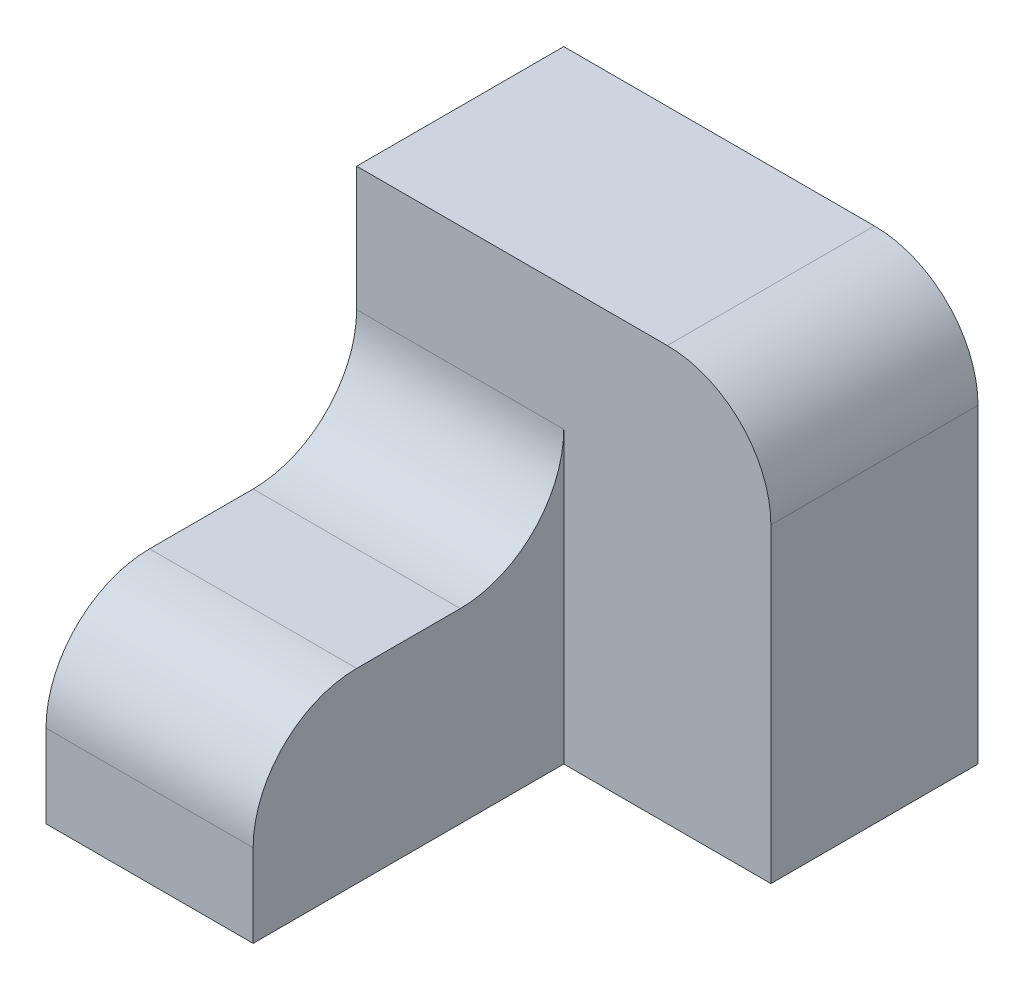
from build123d import *

# Parameters (mm, degrees)
SKETCH1_W           = 20
SKETCH1_H           = 18
BOSS_EXTRUDE1_DEPTH = 30
SKETCH2_W           = 40
SKETCH2_H           = 40
BOSS_EXTRUDE2_DEPTH = 20
FILLET1_R           = 10


with BuildPart() as part:
    # Sketch1 → Boss-Extrude1 (new body)
    with BuildSketch(Plane.XY):
        with Locations((-20, -9)):
            Rectangle(SKETCH1_W, SKETCH1_H)
    extrude(amount=BOSS_EXTRUDE1_DEPTH)

    # Sketch2 → Boss-Extrude2 (add)
    with BuildSketch(Plane.XY):
        with Locations((-10, 2)):
            Rectangle(SKETCH2_W, SKETCH2_H)
    extrude(amount=-BOSS_EXTRUDE2_DEPTH)

    # Fillet1
    fillet1_edges = [part.edges().sort_by_distance(p)[0] for p in [
        (-20, 0, 0),
        (10, 22, -10),
        (-20, 0, 30),
    ]]
    fillet(fillet1_edges, radius=FILLET1_R)


solid = part.part
